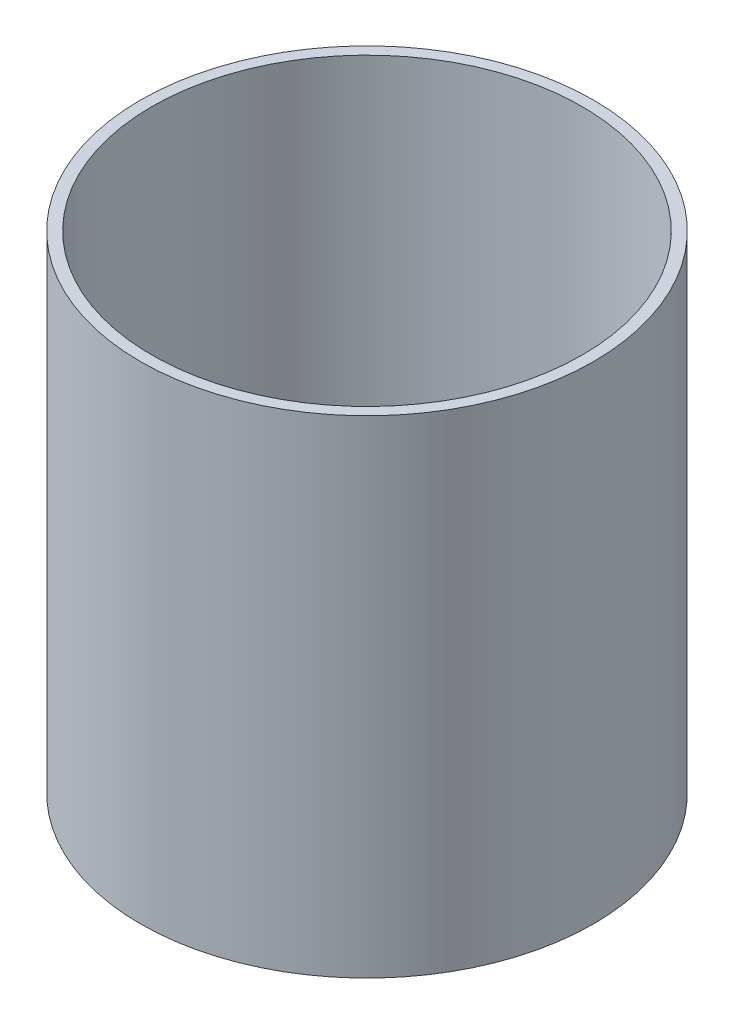
from build123d import *

# Parameters (mm, degrees)
SKETCH1_R           = 60
SKETCH1_R_2         = 57
EXTRUDE_THIN1_DEPTH = 129


with BuildPart() as part:
    # Sketch1 → Extrude-Thin1 (new body)
    with BuildSketch(Plane(origin=(0, 0, 0), x_dir=(1, 0, 0), z_dir=(0, 1, 0))):
        Circle(SKETCH1_R)
        Circle(SKETCH1_R_2, mode=Mode.SUBTRACT)
    extrude(amount=EXTRUDE_THIN1_DEPTH)


solid = part.part
